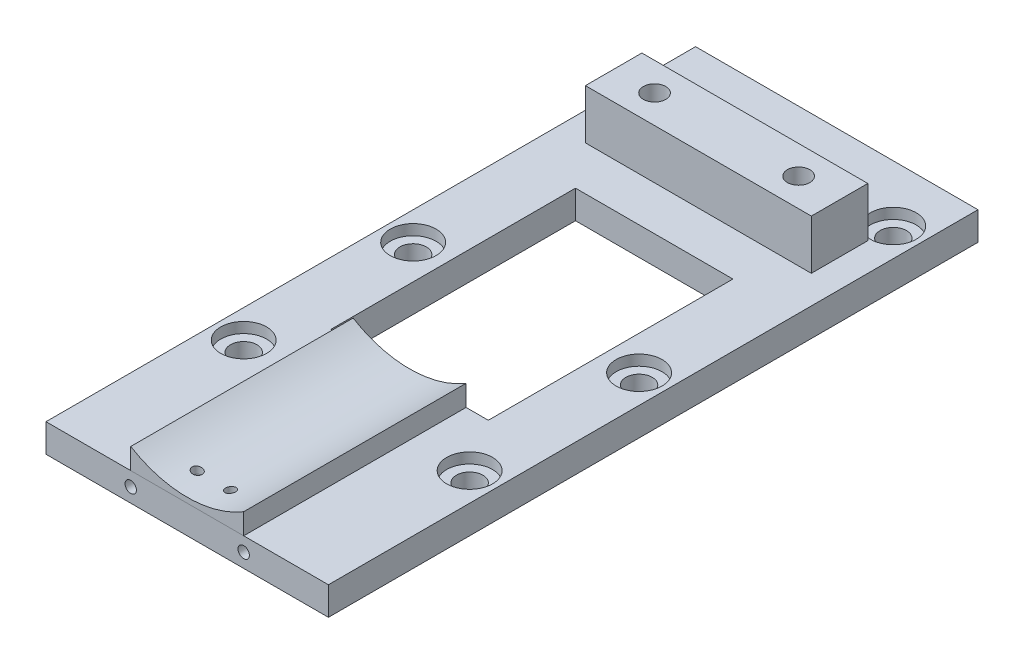
from build123d import *

# Parameters (mm, degrees)
SKETCH1_W                                = 50.8
SKETCH1_H                                = 160
BOSS_EXTRUDE1_DEPTH                      = 30
SKETCH4_R                                = 49
CUT_EXTRUDE1_DEPTH                       = 100
CBORE_FOR_M4_SHCS1_D                     = 4.5
CBORE_FOR_M4_SHCS1_CBORE_D               = 8
CBORE_FOR_M4_SHCS1_CBORE_DEPTH           = 4
SKETCH7_R                                = 57
CUT_EXTRUDE10_DEPTH                      = 60
SKETCH39_W                               = 38.1
SKETCH39_H                               = 304.8
BOSS_EXTRUDE9_DEPTH                      = 12.7
SKETCH30_W                               = 101.6
SKETCH30_H                               = 25.4
BOSS_EXTRUDE8_DEPTH                      = 35
SKETCH40_W                               = 50.8
SKETCH40_H                               = 144.8
BOSS_EXTRUDE10_DEPTH                     = 12.7
HOLE1_D                                  = 11.90625
HOLE1_CBORE_D                            = 20.6502
HOLE1_CBORE_DEPTH                        = 4.7498
TAP_DRILL_FOR_1_4_20_TAP1_D              = 5.1054
TAP_DRILL_FOR_1_4_20_TAP1_DEPTH          = 12.7
TAP_DRILL_FOR_1_4_20_TAP1_TIP            = 1.533816902
CUT_EXTRUDE11_START                      = -12.7
SKETCH44_W                               = 70.8
SKETCH44_H                               = 110
CUT_EXTRUDE11_DEPTH                      = 12.972164
CBORE_FOR_3_8_HEX_HEAD_BOLT1_D           = 10.0838
CBORE_FOR_3_8_HEX_HEAD_BOLT1_CBORE_D     = 22.225
CBORE_FOR_3_8_HEX_HEAD_BOLT1_CBORE_DEPTH = 25.4
SKETCH45_W                               = 127
SKETCH45_H                               = 12.7
CUT_EXTRUDE12_DEPTH                      = 12.7
SPLIT1_SURFACE_1_BACK                    = 321.432
SPLIT1_SURFACE_1_DEPTH                   = 642.864
SPLIT1_SURFACE_2_BACK                    = 321.432
SPLIT1_SURFACE_2_DEPTH                   = 642.864


# Read off the part's stored shape, not the designer's step: Split2
with BuildPart() as part:
    # Sketch1 → Boss-Extrude1 (new body)
    with BuildSketch(Plane(origin=(0, 0, 0), x_dir=(1, 0, 0), z_dir=(0, 1, 0))):
        Rectangle(SKETCH1_W, SKETCH1_H)
    extrude(amount=BOSS_EXTRUDE1_DEPTH)

    # Sketch4 → Cut-Extrude1 (cut)
    with BuildSketch(Plane.XY.offset(80)):
        with Locations((0, 64)):
            Circle(SKETCH4_R)
    extrude(amount=-CUT_EXTRUDE1_DEPTH, mode=Mode.SUBTRACT)

    # CBORE for M4 SHCS1 (through all)
    with Locations(Plane(origin=(0, 0, 0), x_dir=(-1, 0, 0), z_dir=(0, -1, 0))):
        with Locations((7.5, -68), (-7.5, -68)):
            CounterBoreHole(CBORE_FOR_M4_SHCS1_D / 2, CBORE_FOR_M4_SHCS1_CBORE_D / 2, CBORE_FOR_M4_SHCS1_CBORE_DEPTH)

    # Sketch7 → Cut-Extrude10 (cut)
    with BuildSketch(Plane(origin=(0, 0, -80), x_dir=(-1, 0, 0), z_dir=(0, 0, -1))):
        with Locations((0, 64)):
            Circle(SKETCH7_R)
    extrude(amount=-CUT_EXTRUDE10_DEPTH, mode=Mode.SUBTRACT)

    # Sketch39 → Boss-Extrude9 (add)
    with BuildSketch(Plane(origin=(0, 0, 0), x_dir=(-1, 0, 0), z_dir=(0, -1, 0))):
        with Locations((-44.45, 72.4)):
            Rectangle(SKETCH39_W, SKETCH39_H)
    boss_extrude9 = extrude(amount=-BOSS_EXTRUDE9_DEPTH)

    # Sketch30 → Boss-Extrude8 (add)
    with BuildSketch(Plane(origin=(0, 0, 0), x_dir=(-1, 0, 0), z_dir=(0, -1, 0))):
        with Locations((0, 162.55)):
            Rectangle(SKETCH30_W, SKETCH30_H)
    extrude(amount=-BOSS_EXTRUDE8_DEPTH)

    # Sketch40 → Boss-Extrude10 (add)
    with BuildSketch(Plane(origin=(0, 0, 0), x_dir=(-1, 0, 0), z_dir=(0, -1, 0))):
        with Locations((0, 152.4)):
            Rectangle(SKETCH40_W, SKETCH40_H)
    extrude(amount=-BOSS_EXTRUDE10_DEPTH)

    # Hole1 (through all)
    with Locations(Plane(origin=(0, 12.7, 0), x_dir=(1, 0, 0), z_dir=(0, 1, 0))):
        with Locations((50.8, -3.8), (50.8, 186.7), (50.8, 72.4)):
            hole1 = CounterBoreHole(HOLE1_D / 2, HOLE1_CBORE_D / 2, HOLE1_CBORE_DEPTH)

    # Mirror1: Boss-Extrude9, Hole1 across plane
    add(boss_extrude9.mirror(Plane(origin=(0, 0, 0), x_dir=(0, 0, 1), z_dir=(1, 0, 0))))
    add(hole1.mirror(Plane(origin=(0, 0, 0), x_dir=(0, 0, 1), z_dir=(1, 0, 0))), mode=Mode.SUBTRACT)

    # Tap Drill for 1/4-20 Tap1
    with Locations(Plane.XY.offset(80)):
        with Locations((25.4, 6.35), (-25.4, 6.35)):
            Hole(TAP_DRILL_FOR_1_4_20_TAP1_D / 2, depth=TAP_DRILL_FOR_1_4_20_TAP1_DEPTH)
            with Locations((0, 0, -(TAP_DRILL_FOR_1_4_20_TAP1_DEPTH + TAP_DRILL_FOR_1_4_20_TAP1_TIP / 2))):  # 118° drill point
                Cone(0, TAP_DRILL_FOR_1_4_20_TAP1_D / 2, TAP_DRILL_FOR_1_4_20_TAP1_TIP, mode=Mode.SUBTRACT)

    # Sketch44 → Cut-Extrude11 (cut)
    with BuildSketch(Plane(origin=(0, 12.7, 0), x_dir=(1, 0, 0), z_dir=(0, 1, 0)).offset(CUT_EXTRUDE11_START)):
        with Locations((0, 75)):
            Rectangle(SKETCH44_W, SKETCH44_H)
    extrude(amount=CUT_EXTRUDE11_DEPTH, mode=Mode.SUBTRACT)

    # CBORE for 3/8 Hex Head Bolt1 (through all)
    with Locations(Plane.XZ):
        with Locations((32.385, -162.55), (-32.385, -162.55)):
            CounterBoreHole(CBORE_FOR_3_8_HEX_HEAD_BOLT1_D / 2, CBORE_FOR_3_8_HEX_HEAD_BOLT1_CBORE_D / 2, CBORE_FOR_3_8_HEX_HEAD_BOLT1_CBORE_DEPTH)

    # Sketch45 → Cut-Extrude12 (cut)
    with BuildSketch(Plane(origin=(0, 0, -224.8), x_dir=(-1, 0, 0), z_dir=(0, 0, -1))):
        with Locations((0, 6.35)):
            Rectangle(SKETCH45_W, SKETCH45_H)
    extrude(amount=-CUT_EXTRUDE12_DEPTH, mode=Mode.SUBTRACT)


with BuildPart() as body_2:
    # Split1: the piece behind the surface
    add(part.part)
    # Split1 surface: a surface, the sketch's curves swept straight by 642.864 mm
    with BuildLine(Plane.ZY.offset(25.4).offset(-SPLIT1_SURFACE_1_BACK), mode=Mode.PRIVATE) as split1_surface_1_path:
        Line((-20, 12.7), (-20, 22.09725546))
        Line((-20, 22.09725546), (80, 22.09725546))
        Line((80, 22.09725546), (80, 12.7))
        Line((80, 12.7), (-20, 12.7))
    split1_surface_1 = Shell.extrude(split1_surface_1_path.wire(), (-1 * SPLIT1_SURFACE_1_DEPTH, 0 * SPLIT1_SURFACE_1_DEPTH, 0 * SPLIT1_SURFACE_1_DEPTH))
    split(bisect_by=split1_surface_1, keep=Keep.BOTTOM)


with BuildPart() as part_1:
    add(part.part)

    # Split1: split by a surface, the side it looks to stays
    # Split1 surface: a surface, the sketch's curves swept straight by 642.864 mm
    with BuildLine(Plane.ZY.offset(25.4).offset(-SPLIT1_SURFACE_2_BACK), mode=Mode.PRIVATE) as split1_surface_2_path:
        Line((-20, 12.7), (-20, 22.09725546))
        Line((-20, 22.09725546), (80, 22.09725546))
        Line((80, 22.09725546), (80, 12.7))
        Line((80, 12.7), (-20, 12.7))
    split1_surface_2 = Shell.extrude(split1_surface_2_path.wire(), (-1 * SPLIT1_SURFACE_2_DEPTH, 0 * SPLIT1_SURFACE_2_DEPTH, 0 * SPLIT1_SURFACE_2_DEPTH))
    split(bisect_by=split1_surface_2, keep=Keep.TOP)


with BuildPart() as body_3:
    # Split2: the piece on the far side of the plane
    add(part_1.part)
    split(bisect_by=Plane(origin=(0, 12.7, 0), x_dir=(1, 0, 0), z_dir=(0, 1, 0)), keep=Keep.BOTTOM)


with BuildPart() as part_2:
    add(part_1.part)

    # Split2
    split(bisect_by=Plane(origin=(0, 12.7, 0), x_dir=(1, 0, 0), z_dir=(0, 1, 0)), keep=Keep.TOP)


solid = Compound([body_2.part, body_3.part, part_2.part])
